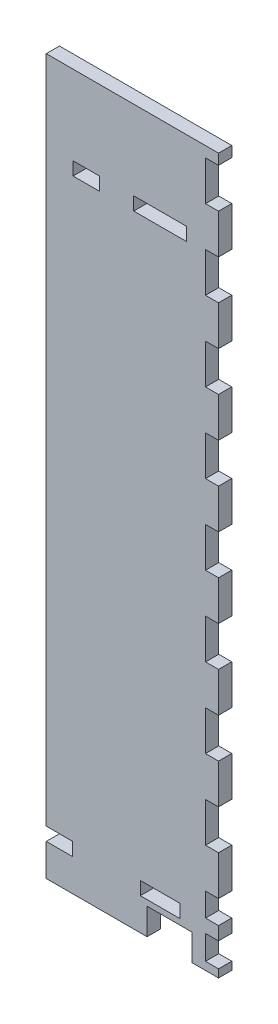
from build123d import *

# Parameters (mm, degrees)
ESQUISSE1_W             = 65.121094869
ESQUISSE1_H             = 270
BOSS_EXTRU_1_DEPTH      = 5
ESQUISSE2_W             = 10
ESQUISSE2_H             = 5
ESQUISSE2_W_2           = 15
ESQUISSE2_W_3           = 4.92
ESQUISSE2_H_2           = 9.15
ESQUISSE2_H_3           = 8.85
ESQUISSE2_H_4           = 15
ESQUISSE2_W_4           = 20
ENL_V_MAT_EXTRU_1_DEPTH = 5
ESQUISSE3_W             = 17
ESQUISSE3_H             = 10
ENL_V_MAT_EXTRU_2_DEPTH = 5


with BuildPart() as part:
    # Esquisse1 → Boss.-Extru.1 (new body)
    with BuildSketch(Plane.XY):
        with Locations((32.560547435, 135)):
            Rectangle(ESQUISSE1_W, ESQUISSE1_H)
    extrude(amount=-BOSS_EXTRU_1_DEPTH)

    # Esquisse2 → Enlèv. mat.-Extru.1 (cut)
    with BuildSketch(Plane.XY):
        with Locations((5, 14.65)):
            Rectangle(ESQUISSE2_W, ESQUISSE2_H)
        with Locations((43.049292824, 14.65)):
            Rectangle(ESQUISSE2_W_2, ESQUISSE2_H)
        with Locations((62.661094869, 7.575)):
            Rectangle(ESQUISSE2_W_3, ESQUISSE2_H_2)
        with Locations((62.661094869, 21.575)):
            Rectangle(ESQUISSE2_W_3, ESQUISSE2_H_3)
        with Locations((62.661094869, 258.5)):
            Rectangle(ESQUISSE2_W_3, ESQUISSE2_H_4)
        with Locations((62.661094869, 228.5)):
            Rectangle(ESQUISSE2_W_3, ESQUISSE2_H_4)
        with Locations((62.661094869, 198.5)):
            Rectangle(ESQUISSE2_W_3, ESQUISSE2_H_4)
        with Locations((62.661094869, 168.5)):
            Rectangle(ESQUISSE2_W_3, ESQUISSE2_H_4)
        with Locations((62.661094869, 138.5)):
            Rectangle(ESQUISSE2_W_3, ESQUISSE2_H_4)
        with Locations((62.661094869, 108.5)):
            Rectangle(ESQUISSE2_W_3, ESQUISSE2_H_4)
        with Locations((62.661094869, 78.5)):
            Rectangle(ESQUISSE2_W_3, ESQUISSE2_H_4)
        with Locations((62.661094869, 48.5)):
            Rectangle(ESQUISSE2_W_3, ESQUISSE2_H_4)
        with Locations((15.121094869, 237.5)):
            Rectangle(ESQUISSE2_W, ESQUISSE2_H)
        with Locations((43.049292824, 237.5)):
            Rectangle(ESQUISSE2_W_4, ESQUISSE2_H)
    extrude(amount=-ENL_V_MAT_EXTRU_1_DEPTH, mode=Mode.SUBTRACT)

    # Esquisse3 → Enlèv. mat.-Extru.2 (cut)
    with BuildSketch(Plane.XY):
        with Locations((46.621094869, 5)):
            Rectangle(ESQUISSE3_W, ESQUISSE3_H)
    extrude(amount=-ENL_V_MAT_EXTRU_2_DEPTH, mode=Mode.SUBTRACT)


solid = part.part
